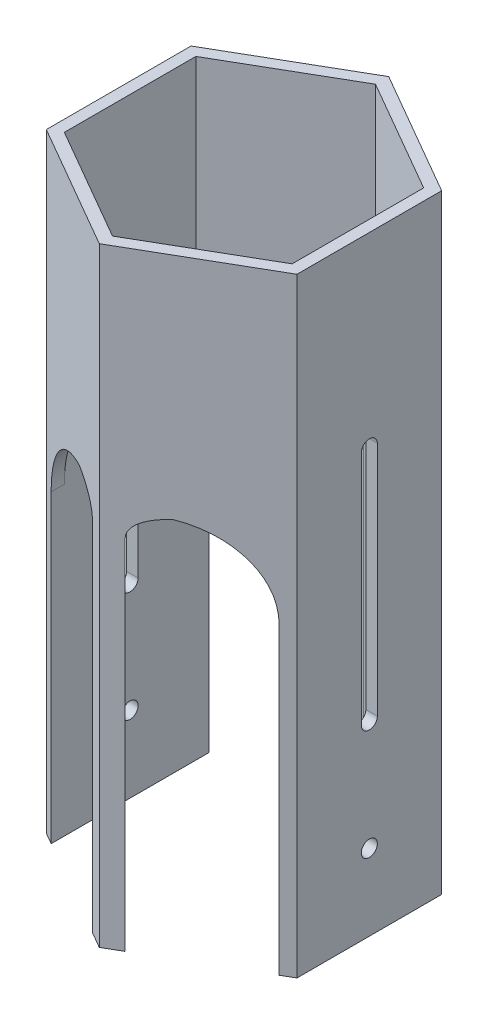
from build123d import *

# Parameters (mm, degrees)
BOSS_EXTRUDE1_DEPTH     = 80
CUT_EXTRUDE1_DEPTH      = 89.561918076
CUT_EXTRUDE1_DEPTH_BACK = 89.561918076
SKETCH3_R               = 1.05
CUT_EXTRUDE2_DEPTH      = 89.561918076
CUT_EXTRUDE3_DEPTH      = 50
FILLET2_R               = 10
FILLET3_R               = 3


with BuildPart() as part:
    # Sketch1 → Boss-Extrude1 (new body)
    with BuildSketch(Plane(origin=(0, 0, 0), x_dir=(1, 0, 0), z_dir=(0, 1, 0))):
        Polygon((16.45, -9.497411928), (16.45, 9.497411928), (0, 18.994823856), (-16.45, 9.497411928), (-16.45, -9.497411928), (0, -18.994823856), align=None)
        Polygon((14.95, 8.631386524), (0, 17.262773049), (-14.95, 8.631386524), (-14.95, -8.631386524), (0, -17.262773049), (14.95, -8.631386524), align=None, mode=Mode.SUBTRACT)
    extrude(amount=BOSS_EXTRUDE1_DEPTH)

    # Sketch2 → Cut-Extrude1 (cut, two sides: drawn at the far end of the back side and taken through both)
    with BuildSketch(Plane(origin=(-16.45, 0, 0), x_dir=(0, 0, -1), z_dir=(1, 0, 0)).offset(-CUT_EXTRUDE1_DEPTH_BACK)):
        with BuildLine():
            Line((1.05, 55.5), (1.05, 24.5))
            ThreePointArc((1.05, 24.5), (0, 23.45), (-1.05, 24.5))
            Line((-1.05, 24.5), (-1.05, 55.5))
            ThreePointArc((-1.05, 55.5), (0, 56.55), (1.05, 55.5))
        make_face()
    extrude(amount=CUT_EXTRUDE1_DEPTH + CUT_EXTRUDE1_DEPTH_BACK, mode=Mode.SUBTRACT)

    # Sketch3 → Cut-Extrude2 (cut, through all)
    with BuildSketch(Plane(origin=(-16.45, 0, 0), x_dir=(0, 0, -1), z_dir=(1, 0, 0))):
        with Locations(Location((0, 10, 0), (0, 0, 180))):
            Circle(SKETCH3_R)
    extrude(amount=CUT_EXTRUDE2_DEPTH, mode=Mode.SUBTRACT)

    # Sketch5 → Cut-Extrude3 (cut)
    with BuildSketch(Plane.XZ):
        Polygon((-14.95, 10.363437332), (-14.95, 8.631386524), (0, 17.262773049), (14.95, 8.631386524), (14.95, 10.363437332), (2.156098166, 17.75), (-2.156098166, 17.75), align=None)
        Polygon((-14.95, -10.363437332), (-2.156098166, -17.75), (2.156098166, -17.75), (14.95, -10.363437332), (14.95, -8.631386524), (0, -17.262773049), (-14.95, -8.631386524), align=None)
    extrude(amount=-CUT_EXTRUDE3_DEPTH, mode=Mode.SUBTRACT)

    # Fillet2
    # the kernel refuses this fillet: 10 mm, written as the material it adds along each edge
    with BuildSketch(Plane(origin=(14.95, 50, -16.368613476), x_dir=(0, -1, 0), z_dir=(0, 0, 1))) as fillet2_piece_1_section:
        with BuildLine():
            CenterArc((FILLET2_R, -FILLET2_R), FILLET2_R, 90, 90)
            Line((0, -FILLET2_R), (0, 0))
            Line((0, 0), (FILLET2_R, 0))
        make_face()
    fillet2_piece_1 = extrude(amount=51.732050808, mode=Mode.PRIVATE)
    fillet2_piece_1 = split(fillet2_piece_1, bisect_by=Plane(origin=(12.341320611, 47.766320611, -10.137508272), z_dir=(0.5000000000000004, 0, -0.8660254037844385)), keep=Keep.TOP, mode=Mode.PRIVATE)
    fillet2_piece_1 = split(fillet2_piece_1, bisect_by=Plane(origin=(13.091320611, 47.766320611, -11.436546378), z_dir=(-0.5000000000000003, 0, 0.8660254037844385)), keep=Keep.TOP, mode=Mode.PRIVATE)
    add(fillet2_piece_1)
    with BuildSketch(Plane(origin=(14.95, 50, -16.368613476), x_dir=(0, -1, 0), z_dir=(0, 0, 1))) as fillet2_piece_2_section:
        with BuildLine():
            CenterArc((FILLET2_R, -FILLET2_R), FILLET2_R, 90, 90)
            Line((0, -FILLET2_R), (0, 0))
            Line((0, 0), (FILLET2_R, 0))
        make_face()
    fillet2_piece_2 = extrude(amount=51.732050808, mode=Mode.PRIVATE)
    fillet2_piece_2 = split(fillet2_piece_2, bisect_by=Plane(origin=(12.341320611, 47.766320611, 10.137508272), z_dir=(0.49999999999999967, 0, 0.8660254037844388)), keep=Keep.TOP, mode=Mode.PRIVATE)
    fillet2_piece_2 = split(fillet2_piece_2, bisect_by=Plane(origin=(13.091320611, 47.766320611, 11.436546378), z_dir=(-0.4999999999999997, 0, -0.8660254037844388)), keep=Keep.TOP, mode=Mode.PRIVATE)
    add(fillet2_piece_2)
    with BuildSketch(Plane(origin=(-14.95, 50, 35.363437332), x_dir=(1, 0, 0), z_dir=(0, 0, -1))) as fillet2_piece_3_section:
        with BuildLine():
            CenterArc((FILLET2_R, FILLET2_R), FILLET2_R, 180, 90)
            Line((0, FILLET2_R), (0, 0))
            Line((0, 0), (FILLET2_R, 0))
        make_face()
    fillet2_piece_3 = extrude(amount=51.732050808, mode=Mode.PRIVATE)
    fillet2_piece_3 = split(fillet2_piece_3, bisect_by=Plane(origin=(-13.091320611, 47.766320611, 11.436546378), z_dir=(0.5000000000000001, 0, -0.8660254037844387)), keep=Keep.TOP, mode=Mode.PRIVATE)
    fillet2_piece_3 = split(fillet2_piece_3, bisect_by=Plane(origin=(-12.341320611, 47.766320611, 10.137508272), z_dir=(-0.5000000000000002, 0, 0.8660254037844386)), keep=Keep.TOP, mode=Mode.PRIVATE)
    add(fillet2_piece_3)
    with BuildSketch(Plane(origin=(-14.95, 50, 35.363437332), x_dir=(1, 0, 0), z_dir=(0, 0, -1))) as fillet2_piece_4_section:
        with BuildLine():
            CenterArc((FILLET2_R, FILLET2_R), FILLET2_R, 180, 90)
            Line((0, FILLET2_R), (0, 0))
            Line((0, 0), (FILLET2_R, 0))
        make_face()
    fillet2_piece_4 = extrude(amount=51.732050808, mode=Mode.PRIVATE)
    fillet2_piece_4 = split(fillet2_piece_4, bisect_by=Plane(origin=(-13.091320611, 47.766320611, -11.436546378), z_dir=(0.49999999999999956, 0, 0.8660254037844389)), keep=Keep.TOP, mode=Mode.PRIVATE)
    fillet2_piece_4 = split(fillet2_piece_4, bisect_by=Plane(origin=(-12.341320611, 47.766320611, -10.137508272), z_dir=(-0.49999999999999956, 0, -0.8660254037844389)), keep=Keep.TOP, mode=Mode.PRIVATE)
    add(fillet2_piece_4)
    with BuildSketch(Plane(origin=(14.95, 50, -35.363437332), x_dir=(0, -1, 0), z_dir=(0, 0, 1))) as fillet2_piece_5_section:
        with BuildLine():
            CenterArc((FILLET2_R, -FILLET2_R), FILLET2_R, 90, 90)
            Line((0, -FILLET2_R), (0, 0))
            Line((0, 0), (FILLET2_R, 0))
        make_face()
    fillet2_piece_5 = extrude(amount=51.732050808, mode=Mode.PRIVATE)
    fillet2_piece_5 = split(fillet2_piece_5, bisect_by=Plane(origin=(12.341320611, 47.766320611, -10.137508272), z_dir=(0.5000000000000004, 0, -0.8660254037844385)), keep=Keep.TOP, mode=Mode.PRIVATE)
    fillet2_piece_5 = split(fillet2_piece_5, bisect_by=Plane(origin=(13.091320611, 47.766320611, -11.436546378), z_dir=(-0.5000000000000003, 0, 0.8660254037844385)), keep=Keep.TOP, mode=Mode.PRIVATE)
    add(fillet2_piece_5)
    with BuildSketch(Plane(origin=(14.95, 50, -35.363437332), x_dir=(0, -1, 0), z_dir=(0, 0, 1))) as fillet2_piece_6_section:
        with BuildLine():
            CenterArc((FILLET2_R, -FILLET2_R), FILLET2_R, 90, 90)
            Line((0, -FILLET2_R), (0, 0))
            Line((0, 0), (FILLET2_R, 0))
        make_face()
    fillet2_piece_6 = extrude(amount=51.732050808, mode=Mode.PRIVATE)
    fillet2_piece_6 = split(fillet2_piece_6, bisect_by=Plane(origin=(12.341320611, 47.766320611, 10.137508272), z_dir=(0.49999999999999967, 0, 0.8660254037844388)), keep=Keep.TOP, mode=Mode.PRIVATE)
    fillet2_piece_6 = split(fillet2_piece_6, bisect_by=Plane(origin=(13.091320611, 47.766320611, 11.436546378), z_dir=(-0.4999999999999997, 0, -0.8660254037844388)), keep=Keep.TOP, mode=Mode.PRIVATE)
    add(fillet2_piece_6)
    with BuildSketch(Plane(origin=(-14.95, 50, 16.368613476), x_dir=(0, -1, 0), z_dir=(0, 0, -1))) as fillet2_piece_7_section:
        with BuildLine():
            CenterArc((FILLET2_R, -FILLET2_R), FILLET2_R, 90, 90)
            Line((0, -FILLET2_R), (0, 0))
            Line((0, 0), (FILLET2_R, 0))
        make_face()
    fillet2_piece_7 = extrude(amount=51.732050808, mode=Mode.PRIVATE)
    fillet2_piece_7 = split(fillet2_piece_7, bisect_by=Plane(origin=(-13.091320611, 47.766320611, 11.436546378), z_dir=(0.5000000000000001, 0, -0.8660254037844387)), keep=Keep.TOP, mode=Mode.PRIVATE)
    fillet2_piece_7 = split(fillet2_piece_7, bisect_by=Plane(origin=(-12.341320611, 47.766320611, 10.137508272), z_dir=(-0.5000000000000002, 0, 0.8660254037844386)), keep=Keep.TOP, mode=Mode.PRIVATE)
    add(fillet2_piece_7)
    with BuildSketch(Plane(origin=(-14.95, 50, 16.368613476), x_dir=(0, -1, 0), z_dir=(0, 0, -1))) as fillet2_piece_8_section:
        with BuildLine():
            CenterArc((FILLET2_R, -FILLET2_R), FILLET2_R, 90, 90)
            Line((0, -FILLET2_R), (0, 0))
            Line((0, 0), (FILLET2_R, 0))
        make_face()
    fillet2_piece_8 = extrude(amount=51.732050808, mode=Mode.PRIVATE)
    fillet2_piece_8 = split(fillet2_piece_8, bisect_by=Plane(origin=(-13.091320611, 47.766320611, -11.436546378), z_dir=(0.49999999999999956, 0, 0.8660254037844389)), keep=Keep.TOP, mode=Mode.PRIVATE)
    fillet2_piece_8 = split(fillet2_piece_8, bisect_by=Plane(origin=(-12.341320611, 47.766320611, -10.137508272), z_dir=(-0.49999999999999956, 0, -0.8660254037844389)), keep=Keep.TOP, mode=Mode.PRIVATE)
    add(fillet2_piece_8)

    # Fillet3
    # the kernel refuses this fillet: 3 mm, written as the material it adds along each edge
    with BuildSketch(Plane(origin=(-9.656098166, 50, -17.75), x_dir=(0, -1, 0), z_dir=(1, 0, 0))) as fillet3_piece_1_section:
        with BuildLine():
            CenterArc((FILLET3_R, -FILLET3_R), FILLET3_R, 90, 90)
            Line((0, -FILLET3_R), (0, 0))
            Line((0, 0), (FILLET3_R, 0))
        make_face()
    fillet3_piece_1 = extrude(amount=19.312196331, mode=Mode.PRIVATE)
    fillet3_piece_1 = split(fillet3_piece_1, bisect_by=Plane(origin=(-1.532605741, 49.425378902, -18.147623386), z_dir=(-0.50000000000019, 0, 0.866025403784329)), keep=Keep.TOP, mode=Mode.PRIVATE)
    fillet3_piece_1 = split(fillet3_piece_1, bisect_by=Plane(origin=(-2.557365025, 49.425378902, -17.51832847), z_dir=(0.50000000000019, 0, 0.866025403784329)), keep=Keep.TOP, mode=Mode.PRIVATE)
    fillet3_piece_1 = split(fillet3_piece_1, bisect_by=Plane(origin=(-1.807365025, 49.425378902, -16.219290365), z_dir=(-0.50000000000019, 0, -0.866025403784329)), keep=Keep.TOP, mode=Mode.PRIVATE)
    add(fillet3_piece_1)
    with BuildSketch(Plane(origin=(-9.656098166, 50, -17.75), x_dir=(0, -1, 0), z_dir=(1, 0, 0))) as fillet3_piece_2_section:
        with BuildLine():
            CenterArc((FILLET3_R, -FILLET3_R), FILLET3_R, 90, 90)
            Line((0, -FILLET3_R), (0, 0))
            Line((0, 0), (FILLET3_R, 0))
        make_face()
    fillet3_piece_2 = extrude(amount=19.312196331, mode=Mode.PRIVATE)
    fillet3_piece_2 = split(fillet3_piece_2, bisect_by=Plane(origin=(-0.169131564, 48.834693799, -17.360421203), z_dir=(0.50000000000019, 0, -0.866025403784329)), keep=Keep.TOP, mode=Mode.PRIVATE)
    fillet3_piece_2 = split(fillet3_piece_2, bisect_by=Plane(origin=(0.169131564, 48.834693799, -17.360421203), z_dir=(-0.50000000000019, 0, -0.866025403784329)), keep=Keep.TOP, mode=Mode.PRIVATE)
    add(fillet3_piece_2)
    with BuildSketch(Plane(origin=(-9.656098166, 50, -17.75), x_dir=(0, -1, 0), z_dir=(1, 0, 0))) as fillet3_piece_3_section:
        with BuildLine():
            CenterArc((FILLET3_R, -FILLET3_R), FILLET3_R, 90, 90)
            Line((0, -FILLET3_R), (0, 0))
            Line((0, 0), (FILLET3_R, 0))
        make_face()
    fillet3_piece_3 = extrude(amount=19.312196331, mode=Mode.PRIVATE)
    fillet3_piece_3 = split(fillet3_piece_3, bisect_by=Plane(origin=(1.807365025, 49.425378902, -16.219290365), z_dir=(0.50000000000019, 0, -0.866025403784329)), keep=Keep.TOP, mode=Mode.PRIVATE)
    fillet3_piece_3 = split(fillet3_piece_3, bisect_by=Plane(origin=(2.557365025, 49.425378902, -17.51832847), z_dir=(-0.50000000000019, 0, 0.866025403784329)), keep=Keep.TOP, mode=Mode.PRIVATE)
    fillet3_piece_3 = split(fillet3_piece_3, bisect_by=Plane(origin=(1.532605741, 49.425378902, -18.147623386), z_dir=(0.50000000000019, 0, 0.866025403784329)), keep=Keep.TOP, mode=Mode.PRIVATE)
    add(fillet3_piece_3)
    with BuildSketch(Plane(origin=(9.656098166, 50, 17.75), x_dir=(0, 0, -1), z_dir=(-1, 0, 0))) as fillet3_piece_4_section:
        with BuildLine():
            CenterArc((FILLET3_R, FILLET3_R), FILLET3_R, 180, 90)
            Line((0, FILLET3_R), (0, 0))
            Line((0, 0), (FILLET3_R, 0))
        make_face()
    fillet3_piece_4 = extrude(amount=19.312196331, mode=Mode.PRIVATE)
    fillet3_piece_4 = split(fillet3_piece_4, bisect_by=Plane(origin=(2.557365029, 49.425378904, 17.518328468), z_dir=(-0.50000000000019, 0, -0.866025403784329)), keep=Keep.TOP, mode=Mode.PRIVATE)
    fillet3_piece_4 = split(fillet3_piece_4, bisect_by=Plane(origin=(1.807365029, 49.425378904, 16.219290363), z_dir=(0.50000000000019, 0, 0.866025403784329)), keep=Keep.TOP, mode=Mode.PRIVATE)
    fillet3_piece_4 = split(fillet3_piece_4, bisect_by=Plane(origin=(1.532605746, 49.425378904, 18.147623389), z_dir=(0.50000000000019, 0, -0.866025403784329)), keep=Keep.TOP, mode=Mode.PRIVATE)
    add(fillet3_piece_4)
    with BuildSketch(Plane(origin=(9.656098166, 50, 17.75), x_dir=(0, 0, -1), z_dir=(-1, 0, 0))) as fillet3_piece_5_section:
        with BuildLine():
            CenterArc((FILLET3_R, FILLET3_R), FILLET3_R, 180, 90)
            Line((0, FILLET3_R), (0, 0))
            Line((0, 0), (FILLET3_R, 0))
        make_face()
    fillet3_piece_5 = extrude(amount=19.312196331, mode=Mode.PRIVATE)
    fillet3_piece_5 = split(fillet3_piece_5, bisect_by=Plane(origin=(-0.169131564, 48.8346938, 17.360421203), z_dir=(0.50000000000019, 0, 0.866025403784329)), keep=Keep.TOP, mode=Mode.PRIVATE)
    fillet3_piece_5 = split(fillet3_piece_5, bisect_by=Plane(origin=(0.169131564, 48.8346938, 17.360421203), z_dir=(-0.50000000000019, 0, 0.866025403784329)), keep=Keep.TOP, mode=Mode.PRIVATE)
    add(fillet3_piece_5)
    with BuildSketch(Plane(origin=(9.656098166, 50, 17.75), x_dir=(0, 0, -1), z_dir=(-1, 0, 0))) as fillet3_piece_6_section:
        with BuildLine():
            CenterArc((FILLET3_R, FILLET3_R), FILLET3_R, 180, 90)
            Line((0, FILLET3_R), (0, 0))
            Line((0, 0), (FILLET3_R, 0))
        make_face()
    fillet3_piece_6 = extrude(amount=19.312196331, mode=Mode.PRIVATE)
    fillet3_piece_6 = split(fillet3_piece_6, bisect_by=Plane(origin=(-2.557365029, 49.425378904, 17.518328468), z_dir=(0.50000000000019, 0, -0.866025403784329)), keep=Keep.TOP, mode=Mode.PRIVATE)
    fillet3_piece_6 = split(fillet3_piece_6, bisect_by=Plane(origin=(-1.532605746, 49.425378904, 18.147623389), z_dir=(-0.50000000000019, 0, -0.866025403784329)), keep=Keep.TOP, mode=Mode.PRIVATE)
    fillet3_piece_6 = split(fillet3_piece_6, bisect_by=Plane(origin=(-1.807365029, 49.425378904, 16.219290363), z_dir=(-0.50000000000019, 0, 0.866025403784329)), keep=Keep.TOP, mode=Mode.PRIVATE)
    add(fillet3_piece_6)


solid = part.part
